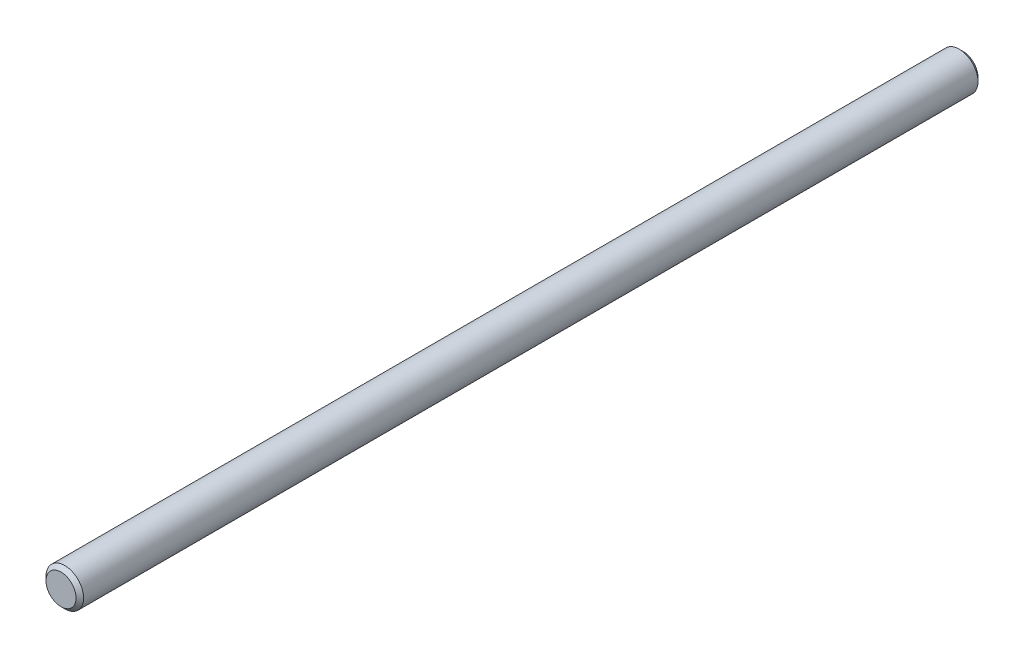
from build123d import *

# Parameters (mm, degrees)
SKETCH3_R           = 1.5875
BOSS_EXTRUDE1_DEPTH = 38.1
CHAMFER1_SIZE       = 0.3175


with BuildPart() as part:
    # Sketch3 → Boss-Extrude1 (new, symmetric)
    with BuildSketch(Plane.XY):
        Circle(SKETCH3_R)
    extrude(amount=BOSS_EXTRUDE1_DEPTH, both=True)

    # Chamfer1
    chamfer1_edges = [part.edges().sort_by_distance(p)[0] for p in [
        (-1.5875, 0, -38.1),
        (-1.5875, 0, 38.1),
    ]]
    chamfer(chamfer1_edges, length=CHAMFER1_SIZE)


solid = part.part
